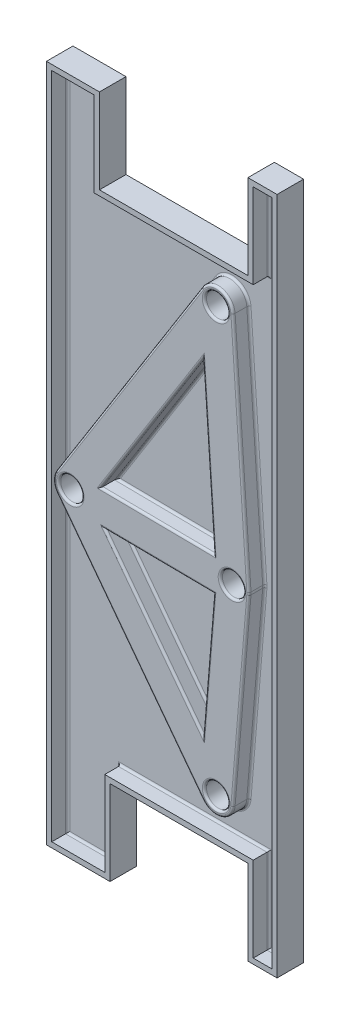
from build123d import *

# Parameters (mm, degrees)
ESQUISSE1_R             = 2
ESQUISSE1_R_2           = 1.996346106
BOSS_EXTRU_2_DEPTH      = 5
ENL_V_MAT_EXTRU_1_DEPTH = 3
ESQUISSE3_R             = 2.2
ENL_V_MAT_EXTRU_2_DEPTH = 3
BOSS_EXTRU_3_START      = 3
ESQUISSE4_R             = 3.2
ESQUISSE4_R_2           = 2.2
BOSS_EXTRU_3_DEPTH      = 3
BOSS_EXTRU_4_START      = 3
BOSS_EXTRU_4_DEPTH      = 3
CONG_1_R                = 0.4
CONG_2_R                = 0.4
CONG_3_R                = 0.4


with BuildPart() as part:
    # Esquisse1 → Boss.-Extru.2 (new body)
    with BuildSketch(Plane.XY):
        Polygon((14, -48), (14, -64), (19.5, -64), (19.5, 64), (14, 64), (14, 48), (-14, 48), (-14, 64), (-24, 64), (-24, -3.700120509), (-24, -64), (-12, -64), (-12, -48), align=None)
        with Locations((11, -4.011390176)):
            Circle(ESQUISSE1_R, mode=Mode.SUBTRACT)
        with Locations((-19.5, -3.700120509)):
            Circle(ESQUISSE1_R_2, mode=Mode.SUBTRACT)
    extrude(amount=BOSS_EXTRU_2_DEPTH)

    # Esquisse2 → Enlèv. mat.-Extru.1 (cut)
    with BuildSketch(Plane.XY.offset(5)):
        Polygon((15, 63), (15, 47), (-15, 47), (-15, 63), (-23, 63), (-23, -63), (-13, -63), (-13, -47), (15, -47), (15, -63), (18.5, -63), (18.5, 63), align=None)
    extrude(amount=-ENL_V_MAT_EXTRU_1_DEPTH, mode=Mode.SUBTRACT)

    # Esquisse3 → Enlèv. mat.-Extru.2 (cut)
    with BuildSketch(Plane.XY.offset(2)):
        with Locations((8, -40)):
            Circle(ESQUISSE3_R)
        with Locations((11, -4.011390176)):
            Circle(ESQUISSE3_R)
        with Locations((-19.5, -3.700120509)):
            Circle(ESQUISSE3_R)
        with Locations((8, 40)):
            Circle(ESQUISSE3_R)
    extrude(amount=-ENL_V_MAT_EXTRU_2_DEPTH, mode=Mode.SUBTRACT)

    # Esquisse4 → Boss.-Extru.3 (add)
    # profile 1 of 4: a face of its own
    with BuildSketch(Plane.XY.offset(2).offset(BOSS_EXTRU_3_START)):
        with Locations((-19.5, -3.700120509)):
            Circle(ESQUISSE4_R)
        with Locations((-19.5, -3.700120509)):
            Circle(ESQUISSE4_R_2, mode=Mode.SUBTRACT)
    # profile 2 of 4: a face of its own
    with BuildSketch(Plane.XY.offset(2).offset(BOSS_EXTRU_3_START)):
        with Locations((8, 40)):
            Circle(ESQUISSE4_R)
        with Locations((8, 40)):
            Circle(ESQUISSE4_R_2, mode=Mode.SUBTRACT)
    # profile 3 of 4: a face of its own
    with BuildSketch(Plane.XY.offset(2).offset(BOSS_EXTRU_3_START)):
        with Locations((11, -4.011390176)):
            Circle(ESQUISSE4_R)
        with Locations((11, -4.011390176)):
            Circle(ESQUISSE4_R_2, mode=Mode.SUBTRACT)
    # profile 4 of 4: a face of its own
    with BuildSketch(Plane.XY.offset(2).offset(BOSS_EXTRU_3_START)):
        with Locations((8, -40)):
            Circle(ESQUISSE4_R)
        with Locations((8, -40)):
            Circle(ESQUISSE4_R_2, mode=Mode.SUBTRACT)
    extrude(amount=-BOSS_EXTRU_3_DEPTH)

    # Esquisse5 → Boss.-Extru.4 (add)
    with BuildSketch(Plane.XY.offset(2).offset(BOSS_EXTRU_4_START)):
        with BuildLine():
            Line((-22.050691786, -5.632469186), (5.449308214, -41.932348677))
            ThreePointArc((5.449308214, -41.932348677), (6.980738924, -36.966667368), (11.2, -40))
            ThreePointArc((11.2, -40), (11.19723367, -40.133029532), (11.188939465, -40.265829062))
            Line((11.188939465, -40.265829062), (14.188939468, -4.277219196))
            ThreePointArc((14.188939468, -4.277219196), (7.800091306, -3.987216857), (14.192591629, -3.793769652))
            Line((14.192591629, -3.793769652), (11.192591639, 40.217620368))
            ThreePointArc((11.192591639, 40.217620368), (11.198147374, 40.108873216), (11.2, 40))
            ThreePointArc((11.2, 40), (7.113082744, 36.925365423), (5.291638887, 41.704341538))
            Line((5.291638887, 41.704341538), (-22.208361113, -1.995778971))
            ThreePointArc((-22.208361113, -1.995778971), (-18.613082744, -0.625485932), (-16.3, -3.700120509))
            ThreePointArc((-16.3, -3.700120509), (-18.480738924, -6.733453141), (-22.050691786, -5.632469186))
        make_face()
        Polygon((7.525092364, -7.176093429), (5.505163093, -31.407575558), (-13.010855219, -6.966512525), align=None, mode=Mode.SUBTRACT)
        Polygon((-13.742264019, -0.558714804), (5.475562867, 29.980243408), (7.572053073, -0.776239407), align=None, mode=Mode.SUBTRACT)
    extrude(amount=-BOSS_EXTRU_4_DEPTH)

    # Congé1
    cong_1_edges = [part.edges().sort_by_distance(p)[0] for p in [
        (-22.69699676, -3.838726851, 5),
        (-21.7, -3.700120509, 5),
        (8.781795856, 43.103030009, 5),
        (5.8, 40, 5),
        (8.8, -4.011390176, 5),
        (8.892279066, -43.073082828, 5),
        (5.8, -40, 5),
        (14.199908694, -4.035563495, 5),
        (-4.133350576, 14.710764302, 5),
        (6.52380797, 14.602002001, 5),
        (-2.742881428, -7.071302977, 5),
        (6.515127729, -19.291834493, 5),
        (12.692591634, 18.211925358, 5),
        (-8.300691786, -23.782408932, 5),
        (-3.085105473, -0.667477105, 5),
        (-3.752846063, -19.187044042, 5),
        (-8.458361113, 19.854281284, 5),
        (12.688939466, -22.271524129, 5),
    ]]
    fillet(cong_1_edges, radius=CONG_1_R)

    # Congé2
    # the kernel refuses this fillet: 0.4 mm, written as the material it adds along each edge
    with BuildSketch(Plane(origin=(-19.5, -3.700120509, 2), x_dir=(-0.8463628479272527, 0.5326067307577611, 0), z_dir=(0.5326067307577611, 0.8463628479272527, 0))) as cong_2_piece_1:
        with BuildLine():
            CenterArc((3.2 + CONG_2_R, CONG_2_R), CONG_2_R, 180, 90)
            Line((3.2 + CONG_2_R, 0), (3.2, 0))
            Line((3.2, 0), (3.2, CONG_2_R))
        make_face()
    revolve(axis=Axis((-19.5, -3.700120509, 2), (0, 0, 1)), revolution_arc=69.328529156)
    with BuildSketch(Plane(origin=(8, 40, 2), x_dir=(0.9976848872903038, 0.06800636494133182, 0), z_dir=(0.06800636494133182, -0.9976848872903038, 0))) as cong_2_piece_2:
        with BuildLine():
            CenterArc((3.2 + CONG_2_R, CONG_2_R), CONG_2_R, 180, 90)
            Line((3.2, CONG_2_R), (3.2, 0))
            Line((3.2, 0), (3.2 + CONG_2_R, 0))
        make_face()
    revolve(axis=Axis((8, 40, 2), (0, 0, 1)), revolution_arc=143.918761689)
    with BuildSketch(Plane(origin=(8, -40, 2), x_dir=(-0.7970911832328035, -0.6038589616893412, 0), z_dir=(-0.6038589616893412, 0.7970911832328035, 0))) as cong_2_piece_3:
        with BuildLine():
            CenterArc((3.2 + CONG_2_R, CONG_2_R), CONG_2_R, 180, 90)
            Line((3.2, CONG_2_R), (3.2, 0))
            Line((3.2, 0), (3.2 + CONG_2_R, 0))
        make_face()
    revolve(axis=Axis((8, -40, 2), (0, 0, 1)), revolution_arc=138.088079335)
    with BuildSketch(Plane(origin=(11, -4.011390176, 2), x_dir=(0.9976848839692785, 0.06800641366229479, 0), z_dir=(-0.06800641366229479, 0.9976848839692785, 0))) as cong_2_piece_4:
        with BuildLine():
            CenterArc((3.2 + CONG_2_R, -CONG_2_R), CONG_2_R, 90, 90)
            Line((3.2, -CONG_2_R), (3.2, 0))
            Line((3.2, 0), (3.2 + CONG_2_R, 0))
        make_face()
    revolve(axis=Axis((11, -4.011390176, 2), (0, 0, -1)), revolution_arc=8.664631865)
    with BuildSketch(Plane(origin=(14.192591629, -3.793769652, 2), x_dir=(0.9976848872903039, 0.06800636494133225, -1.1102230246251585e-15), z_dir=(-0.06800636494133225, 0.9976848872903039, 0))) as cong_2_piece_5:
        with BuildLine():
            CenterArc((CONG_2_R, -CONG_2_R), CONG_2_R, 90, 90)
            Line((0, -CONG_2_R), (0, 0))
            Line((0, 0), (CONG_2_R, 0))
        make_face()
    extrude(amount=44.113517786)
    with BuildSketch(Plane(origin=(-22.050691786, -5.632469186, 2), x_dir=(0, 0, 1), z_dir=(0.6038589616893416, -0.7970911832328034, 0))) as cong_2_piece_6:
        with BuildLine():
            CenterArc((CONG_2_R, CONG_2_R), CONG_2_R, 180, 90)
            Line((0, CONG_2_R), (0, 0))
            Line((0, 0), (CONG_2_R, 0))
        make_face()
    extrude(amount=45.540435341)
    with BuildSketch(Plane(origin=(11.188939465, -40.265829062, 2), x_dir=(0.9965435827308107, -0.08307158189200477, -1.110223024625156e-15), z_dir=(0.08307158189200475, 0.9965435827308107, 0))) as cong_2_piece_7:
        with BuildLine():
            CenterArc((CONG_2_R, -CONG_2_R), CONG_2_R, 90, 90)
            Line((0, -CONG_2_R), (0, 0))
            Line((0, 0), (CONG_2_R, 0))
        make_face()
    extrude(amount=36.113432959)
    with BuildSketch(Plane(origin=(5.291638887, 41.704341538, 2), x_dir=(-0.8463628479272527, 0.5326067307577608, -1.1102230246251546e-15), z_dir=(-0.5326067307577609, -0.8463628479272528, 0))) as cong_2_piece_8:
        with BuildLine():
            CenterArc((CONG_2_R, -CONG_2_R), CONG_2_R, 90, 90)
            Line((0, -CONG_2_R), (0, 0))
            Line((0, 0), (CONG_2_R, 0))
        make_face()
    extrude(amount=51.632843545)
    with BuildSketch(Plane(origin=(19.5, 63, 2), x_dir=(0, -1, 0), z_dir=(-1, 0, 0)), Plane(origin=(14, -63, 2), x_dir=(0, 1, 0), z_dir=(1, 0, 0))) as cong_2_piece_9:
        with BuildLine():
            CenterArc((CONG_2_R, CONG_2_R), CONG_2_R, 180, 90)
            Line((0, CONG_2_R), (0, 0))
            Line((0, 0), (CONG_2_R, 0))
        make_face()
    extrude(amount=5.5)
    with BuildSketch(Plane(origin=(18.5, -64, 2), x_dir=(-1, 0, 0), z_dir=(0, 1, 0)), Plane(origin=(-23, 64, 2), x_dir=(1, 0, 0), z_dir=(0, -1, 0))) as cong_2_piece_10:
        with BuildLine():
            CenterArc((CONG_2_R, CONG_2_R), CONG_2_R, 180, 90)
            Line((0, CONG_2_R), (0, 0))
            Line((0, 0), (CONG_2_R, 0))
        make_face()
    extrude(amount=128)
    with BuildSketch(Plane(origin=(15, -47, 2), x_dir=(1, 0, 0), z_dir=(0, -1, 0)), Plane(origin=(-13, -64, 2), x_dir=(-1, 0, 0), z_dir=(0, 1, 0)), Plane(origin=(-15, 47, 2), x_dir=(-1, 0, 0), z_dir=(0, 1, 0)), Plane(origin=(15, 64, 2), x_dir=(1, 0, 0), z_dir=(0, -1, 0))) as cong_2_piece_11:
        with BuildLine():
            CenterArc((CONG_2_R, CONG_2_R), CONG_2_R, 180, 90)
            Line((0, CONG_2_R), (0, 0))
            Line((0, 0), (CONG_2_R, 0))
        make_face()
    extrude(amount=17)
    with BuildSketch(Plane(origin=(-13, -47, 2), x_dir=(0, 1, 0), z_dir=(1, 0, 0))) as cong_2_piece_12:
        with BuildLine():
            CenterArc((CONG_2_R, CONG_2_R), CONG_2_R, 180, 90)
            Line((0, CONG_2_R), (0, 0))
            Line((0, 0), (CONG_2_R, 0))
        make_face()
    extrude(amount=28)
    with BuildSketch(Plane(origin=(-24, -63, 2), x_dir=(0, 1, 0), z_dir=(1, 0, 0))) as cong_2_piece_13:
        with BuildLine():
            CenterArc((CONG_2_R, CONG_2_R), CONG_2_R, 180, 90)
            Line((0, CONG_2_R), (0, 0))
            Line((0, 0), (CONG_2_R, 0))
        make_face()
    extrude(amount=12)
    with BuildSketch(Plane(origin=(-14, 63, 2), x_dir=(0, -1, 0), z_dir=(-1, 0, 0))) as cong_2_piece_14:
        with BuildLine():
            CenterArc((CONG_2_R, CONG_2_R), CONG_2_R, 180, 90)
            Line((0, CONG_2_R), (0, 0))
            Line((0, 0), (CONG_2_R, 0))
        make_face()
    extrude(amount=10)
    with BuildSketch(Plane(origin=(15, 47, 2), x_dir=(0, -1, 0), z_dir=(-1, 0, 0))) as cong_2_piece_15:
        with BuildLine():
            CenterArc((CONG_2_R, CONG_2_R), CONG_2_R, 180, 90)
            Line((0, CONG_2_R), (0, 0))
            Line((0, 0), (CONG_2_R, 0))
        make_face()
    extrude(amount=30)
    with BuildSketch(Plane(origin=(-13, -47, 2), x_dir=(0, 1, 0), z_dir=(1, 0, 0))) as cong_2_piece_16a_section:
        with BuildLine():
            CenterArc((CONG_2_R, CONG_2_R), CONG_2_R, 180, 90)
            Line((0, CONG_2_R), (0, 0))
            Line((0, 0), (CONG_2_R, 0))
        make_face()
    cong_2_piece_16a = extrude(amount=29, mode=Mode.PRIVATE)
    cong_2_piece_16a = split(cong_2_piece_16a, bisect_by=Plane(origin=(15, -46.909441954, 2.090558046), z_dir=(1, 0, 0)), keep=Keep.TOP, mode=Mode.PRIVATE)
    with BuildSketch(Plane(origin=(15, -46, 2), x_dir=(1, 0, 0), z_dir=(0, -1, 0))) as cong_2_piece_16b_section:
        with BuildLine():
            CenterArc((CONG_2_R, CONG_2_R), CONG_2_R, 180, 90)
            Line((0, CONG_2_R), (0, 0))
            Line((0, 0), (CONG_2_R, 0))
        make_face()
    cong_2_piece_16b = extrude(amount=17, mode=Mode.PRIVATE)
    cong_2_piece_16b = split(cong_2_piece_16b, bisect_by=Plane(origin=(15.090558046, -47, 2.090558046), z_dir=(0, 1, 0)), keep=Keep.TOP, mode=Mode.PRIVATE)
    cong_2_piece_16 = cong_2_piece_16a & cong_2_piece_16b
    add(cong_2_piece_16)
    with BuildSketch(Plane(origin=(-13, -63, 2), x_dir=(-1, 0, 0), z_dir=(0, 1, 0))) as cong_2_piece_17a_section:
        with BuildLine():
            CenterArc((CONG_2_R, CONG_2_R), CONG_2_R, 180, 90)
            Line((0, CONG_2_R), (0, 0))
            Line((0, 0), (CONG_2_R, 0))
        make_face()
    cong_2_piece_17a = extrude(amount=17, mode=Mode.PRIVATE)
    cong_2_piece_17a = split(cong_2_piece_17a, bisect_by=Plane(origin=(-13.090558046, -47, 2.090558046), z_dir=(0, 1, 0)), keep=Keep.TOP, mode=Mode.PRIVATE)
    with BuildSketch(Plane(origin=(-14, -47, 2), x_dir=(0, 1, 0), z_dir=(1, 0, 0))) as cong_2_piece_17b_section:
        with BuildLine():
            CenterArc((CONG_2_R, CONG_2_R), CONG_2_R, 180, 90)
            Line((0, CONG_2_R), (0, 0))
            Line((0, 0), (CONG_2_R, 0))
        make_face()
    cong_2_piece_17b = extrude(amount=29, mode=Mode.PRIVATE)
    cong_2_piece_17b = split(cong_2_piece_17b, bisect_by=Plane(origin=(-13, -46.909441954, 2.090558046), z_dir=(-1, 0, 0)), keep=Keep.TOP, mode=Mode.PRIVATE)
    cong_2_piece_17 = cong_2_piece_17a & cong_2_piece_17b
    add(cong_2_piece_17)
    with BuildSketch(Plane(origin=(15, 47, 2), x_dir=(0, -1, 0), z_dir=(-1, 0, 0))) as cong_2_piece_18a_section:
        with BuildLine():
            CenterArc((CONG_2_R, CONG_2_R), CONG_2_R, 180, 90)
            Line((0, CONG_2_R), (0, 0))
            Line((0, 0), (CONG_2_R, 0))
        make_face()
    cong_2_piece_18a = extrude(amount=31, mode=Mode.PRIVATE)
    cong_2_piece_18a = split(cong_2_piece_18a, bisect_by=Plane(origin=(-15, 46.909441954, 2.090558046), z_dir=(-1, 0, 0)), keep=Keep.TOP, mode=Mode.PRIVATE)
    with BuildSketch(Plane(origin=(-15, 46, 2), x_dir=(-1, 0, 0), z_dir=(0, 1, 0))) as cong_2_piece_18b_section:
        with BuildLine():
            CenterArc((CONG_2_R, CONG_2_R), CONG_2_R, 180, 90)
            Line((0, CONG_2_R), (0, 0))
            Line((0, 0), (CONG_2_R, 0))
        make_face()
    cong_2_piece_18b = extrude(amount=17, mode=Mode.PRIVATE)
    cong_2_piece_18b = split(cong_2_piece_18b, bisect_by=Plane(origin=(-15.090558046, 47, 2.090558046), z_dir=(0, -1, 0)), keep=Keep.TOP, mode=Mode.PRIVATE)
    cong_2_piece_18 = cong_2_piece_18a & cong_2_piece_18b
    add(cong_2_piece_18)
    with BuildSketch(Plane(origin=(15, 63, 2), x_dir=(1, 0, 0), z_dir=(0, -1, 0))) as cong_2_piece_19a_section:
        with BuildLine():
            CenterArc((CONG_2_R, CONG_2_R), CONG_2_R, 180, 90)
            Line((0, CONG_2_R), (0, 0))
            Line((0, 0), (CONG_2_R, 0))
        make_face()
    cong_2_piece_19a = extrude(amount=17, mode=Mode.PRIVATE)
    cong_2_piece_19a = split(cong_2_piece_19a, bisect_by=Plane(origin=(15.090558046, 47, 2.090558046), z_dir=(0, -1, 0)), keep=Keep.TOP, mode=Mode.PRIVATE)
    with BuildSketch(Plane(origin=(16, 47, 2), x_dir=(0, -1, 0), z_dir=(-1, 0, 0))) as cong_2_piece_19b_section:
        with BuildLine():
            CenterArc((CONG_2_R, CONG_2_R), CONG_2_R, 180, 90)
            Line((0, CONG_2_R), (0, 0))
            Line((0, 0), (CONG_2_R, 0))
        make_face()
    cong_2_piece_19b = extrude(amount=31, mode=Mode.PRIVATE)
    cong_2_piece_19b = split(cong_2_piece_19b, bisect_by=Plane(origin=(15, 46.909441954, 2.090558046), z_dir=(1, 0, 0)), keep=Keep.TOP, mode=Mode.PRIVATE)
    cong_2_piece_19 = cong_2_piece_19a & cong_2_piece_19b
    add(cong_2_piece_19)

    # Congé3
    cong_3_edges = [part.edges().sort_by_distance(p)[0] for p in [
        (-3.085105473, -0.667477105, 2),
        (-3.752846063, -19.187044042, 2),
        (6.515127729, -19.291834493, 2),
        (-2.742881428, -7.071302977, 2),
        (6.52380797, 14.602002001, 2),
        (-4.133350576, 14.710764302, 2),
    ]]
    fillet(cong_3_edges, radius=CONG_3_R)


solid = part.part
